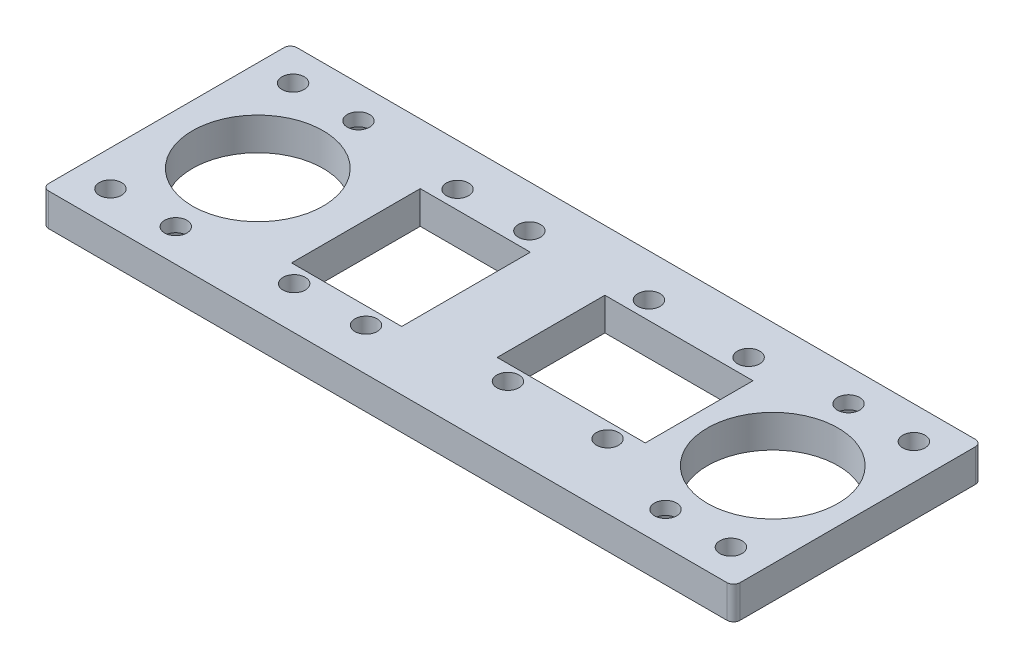
from build123d import *

# Parameters (mm, degrees)
SKETCH1_W           = 105.8
SKETCH1_H           = 37.999959088
SKETCH1_R           = 1.7
SKETCH1_R_2         = 10
SKETCH1_W_2         = 16.85151746
SKETCH1_H_2         = 19.689667769
SKETCH1_W_3         = 22.664698662
SKETCH1_H_3         = 16.485400984
BOSS_EXTRUDE3_DEPTH = 5
FILLET1_R           = 1
CUT_EXTRUDE1_DEPTH  = 3


with BuildPart() as part:
    # Sketch1 → Boss-Extrude3 (new body)
    with BuildSketch(Plane(origin=(0, 0, 0), x_dir=(1, 0, 0), z_dir=(0, 1, 0))):
        with Locations((0, -2.0456e-05)):
            Rectangle(SKETCH1_W, SKETCH1_H)
        with Locations((-47.5, 13.999959088)):
            Circle(SKETCH1_R, mode=Mode.SUBTRACT)
        with Locations((-47.45213511, -14)):
            Circle(SKETCH1_R, mode=Mode.SUBTRACT)
        with Locations((47.5, 13.999959088)):
            Circle(SKETCH1_R, mode=Mode.SUBTRACT)
        with Locations((47.5, -14.000040912)):
            Circle(SKETCH1_R, mode=Mode.SUBTRACT)
        with Locations((-20.838777713, 12.499959088)):
            Circle(SKETCH1_R, mode=Mode.SUBTRACT)
        with Locations((-20.838777713, -12.500040912)):
            Circle(SKETCH1_R, mode=Mode.SUBTRACT)
        with Locations((-9.838777713, 12.499959088)):
            Circle(SKETCH1_R, mode=Mode.SUBTRACT)
        with Locations((-9.838777713, -12.500040912)):
            Circle(SKETCH1_R, mode=Mode.SUBTRACT)
        with Locations((8.468303583, 12.485001846)):
            Circle(SKETCH1_R, mode=Mode.SUBTRACT)
        with Locations((8.468303583, -9.090040912)):
            Circle(SKETCH1_R, mode=Mode.SUBTRACT)
        with Locations((23.708296244, 12.499959088)):
            Circle(SKETCH1_R, mode=Mode.SUBTRACT)
        with Locations((23.708296244, -9.090040912)):
            Circle(SKETCH1_R, mode=Mode.SUBTRACT)
        with Locations((-37.5, 13.999959088)):
            Circle(SKETCH1_R, mode=Mode.SUBTRACT)
        with Locations((-37.45213511, -14)):
            Circle(SKETCH1_R, mode=Mode.SUBTRACT)
        with Locations((37.5, 13.999959088)):
            Circle(SKETCH1_R, mode=Mode.SUBTRACT)
        with Locations((37.5, -14.000040912)):
            Circle(SKETCH1_R, mode=Mode.SUBTRACT)
        with Locations((-38.9, 0)):
            Circle(SKETCH1_R_2, mode=Mode.SUBTRACT)
        with Locations((39.9, 0)):
            Circle(SKETCH1_R_2, mode=Mode.SUBTRACT)
        with Locations((-15.363894899, -0.098030908)):
            Rectangle(SKETCH1_W_2, SKETCH1_H_2, mode=Mode.SUBTRACT)
        with Locations((15.799758129, 1.504102484)):
            Rectangle(SKETCH1_W_3, SKETCH1_H_3, mode=Mode.SUBTRACT)
    extrude(amount=BOSS_EXTRUDE3_DEPTH)

    # Fillet1
    fillet1_edges = [part.edges().sort_by_distance(p)[0] for p in [
        (52.9, 2.5, -18.999959088),
        (52.9, 2.5, 19),
        (-52.9, 2.5, -18.999959088),
        (-52.9, 2.5, 19),
    ]]
    fillet(fillet1_edges, radius=FILLET1_R)

    # Sketch2 → Cut-Extrude1 (cut)
    with BuildSketch(Plane.XZ):
        Polygon((40.611917951, -13.999959088), (39.055958975, -11.304959088), (35.944041025, -11.304959088), (34.388082049, -13.999959088), (35.944041025, -16.694959088), (39.055958975, -16.694959088), align=None)
        Polygon((40.611917951, 14.000040912), (39.055958975, 16.695040912), (35.944041025, 16.695040912), (34.388082049, 14.000040912), (35.944041025, 11.305040912), (39.055958975, 11.305040912), align=None)
        Polygon((-34.34021716, 14), (-35.896176135, 16.695), (-39.008094086, 16.695), (-40.564053061, 14), (-39.008094086, 11.305), (-35.896176135, 11.305), align=None)
        Polygon((-34.388082049, -13.999959088), (-35.944041025, -11.304959088), (-39.055958975, -11.304959088), (-40.611917951, -13.999959088), (-39.055958975, -16.694959088), (-35.944041025, -16.694959088), align=None)
    extrude(amount=-CUT_EXTRUDE1_DEPTH, mode=Mode.SUBTRACT)


solid = part.part
